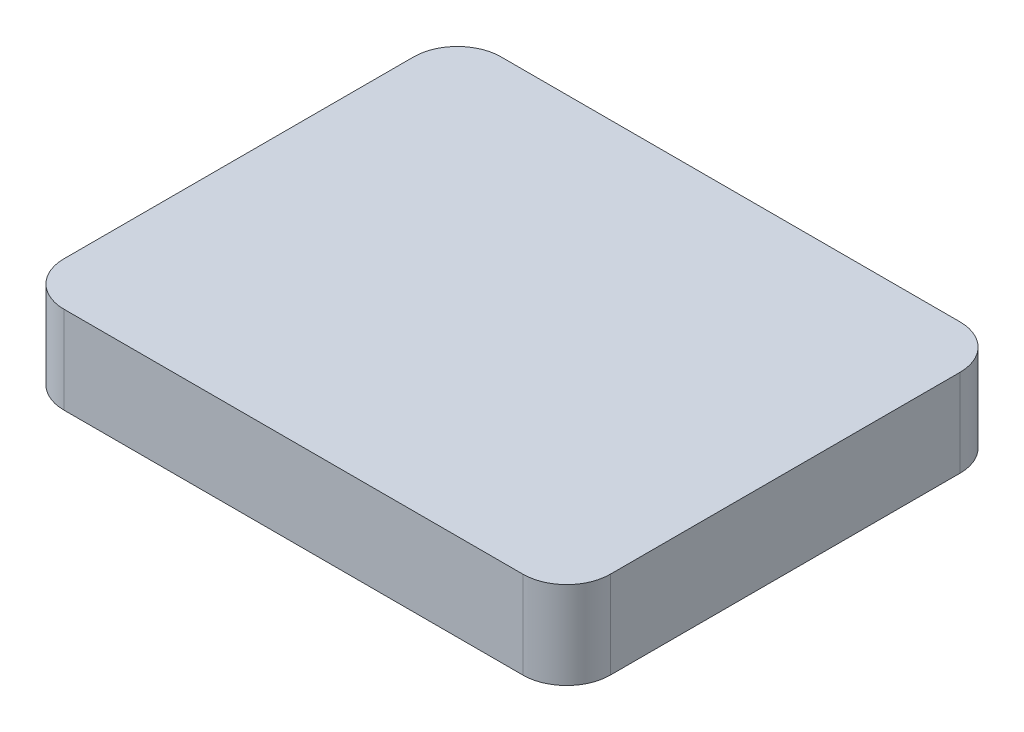
from build123d import *

# Parameters (mm, degrees)
SKETCH1_W              = 250
SKETCH1_H              = 200
BOSS_EXTRUDE1_DEPTH    = 40
MOVE_START             = -125
MOVE_FACE1_OUTLINE_W   = 80
MOVE_FACE1_OUTLINE_H   = 40
MOVE_FACE1_DEPTH       = 250
MOVE_FACE1_2_OUTLINE_W = 40
MOVE_FACE1_2_OUTLINE_H = 80
MOVE_FACE1_2_DEPTH     = 250
FILLET2_R              = 20


# Read off the part's stored shape, not the designer's step: Move Face1
with BuildPart() as part:
    # Sketch1 → Boss-Extrude1 (new body)
    with BuildSketch(Plane.XY):
        Rectangle(SKETCH1_W, SKETCH1_H)
    extrude(amount=BOSS_EXTRUDE1_DEPTH)

    # Move Face1 outline → Move Face1 (cut)
    with BuildSketch(Plane.YZ.offset(MOVE_START)):
        with Locations((-60, 20)):
            Rectangle(MOVE_FACE1_OUTLINE_W, MOVE_FACE1_OUTLINE_H)
        with Locations((60, 20)):
            Rectangle(MOVE_FACE1_OUTLINE_W, MOVE_FACE1_OUTLINE_H)
    extrude(amount=MOVE_FACE1_DEPTH, mode=Mode.SUBTRACT)

    # Move Face1 2 outline → Move Face1 2 (add)
    with BuildSketch(Plane.YZ.offset(MOVE_START)):
        with Locations((0, 80)):
            Rectangle(MOVE_FACE1_2_OUTLINE_W, MOVE_FACE1_2_OUTLINE_H)
        with Locations((0, -40)):
            Rectangle(MOVE_FACE1_2_OUTLINE_W, MOVE_FACE1_2_OUTLINE_H)
    extrude(amount=MOVE_FACE1_2_DEPTH)

    # Fillet2
    fillet2_edges = [part.edges().sort_by_distance(p)[0] for p in [
        (125, 0, -80),
        (-125, 0, -80),
        (-125, 0, 120),
        (125, 0, 120),
    ]]
    fillet(fillet2_edges, radius=FILLET2_R)


solid = part.part
